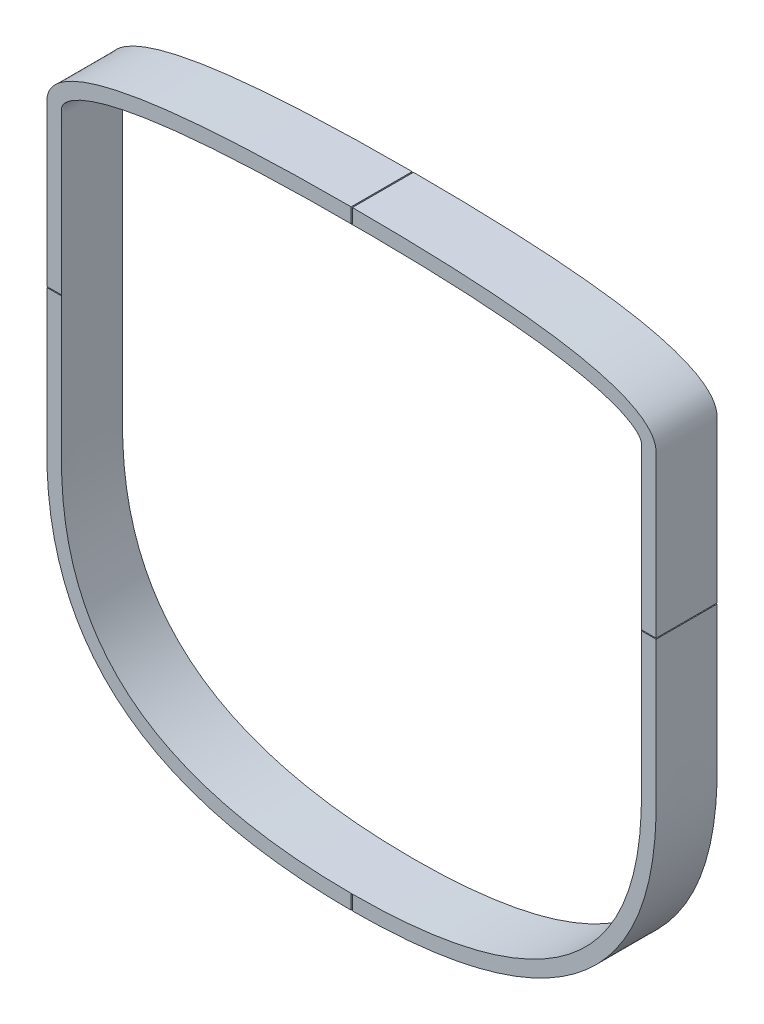
from build123d import *

# Parameters (mm, degrees)
BOSS_EXTRUDE1_DEPTH = 10


with BuildPart() as part:
    # Sketch1 → Boss-Extrude1 (new, symmetric)
    with BuildSketch(Plane.XY):
        with BuildLine():
            Line((-95.144998716, 47.060523193), (-99.799994094, 47.060523194))
            add(Edge.make_bspline(
                [(-99.799994094, 47.060523194), (-99.800007021, 46.135711354), (-99.800068705, 41.700388492), (-99.80014587, 33.754485116), (-99.800505635, 23.223179801), (-99.799679386, 14.4459308), (-99.801136798, 7.426624709), (-99.796894787, 3.033822239), (-99.805308217, -0.465987616), (-99.759141694, -4.156711462), (-99.438712731, -10.542299727), (-98.294238748, -19.729972222), (-95.501671637, -30.617877434), (-91.007467852, -41.089742593), (-84.652074349, -50.663569653), (-76.600245778, -58.862795915), (-67.302957766, -65.435861427), (-53.896056792, -72.115410588), (-36.165000884, -77.150562875), (-18.187624636, -79.297714349), (-6.174368209, -79.759810132), (-1.346346859, -79.801016691), (-0.1, -79.801808559)],
                knots=[0.37088373, 0.37088373, 0.37088373, 0.37088373, 0.375, 0.390625, 0.40625, 0.421875, 0.4296875, 0.4375, 0.44140625, 0.4453125, 0.453125, 0.46875, 0.484375, 0.5, 0.515625, 0.53125, 0.546875, 0.5625, 0.59375, 0.625, 0.640625, 0.64606282, 0.64606282, 0.64606282, 0.64606282], degree=3))
            Line((-0.1, -79.801808559), (-0.1, -75.146205503))
            Line((-0.1, -75.146205503), (0.3, -75.146205503))
            Line((0.3, -75.146205503), (0.3, -79.801724394))
            add(Edge.make_bspline(
                [(0.3, -79.801724394), (2.501532566, -79.799397871), (11.86466932, -79.658552731), (28.468647656, -78.393184478), (49.892541186, -73.78340807), (67.095318032, -66.050228552), (79.086640147, -56.648120321), (86.680517748, -48.016317429), (92.501583857, -38.117867323), (96.476354993, -27.483349983), (98.433155067, -18.360856768), (99.337729137, -11.029098552), (99.655135353, -6.445613725), (99.780918083, -2.7912996), (99.804296451, -0.038361832), (99.799067761, 2.584352582), (99.800472354, 6.091701714), (99.799858203, 10.482871902), (99.800080901, 17.502278893), (99.799972511, 26.279386709), (99.800007066, 36.716753999), (99.800001274, 43.643913188), (99.800000093, 47.060523193)],
                knots=[0.646644559, 0.646644559, 0.646644559, 0.646644559, 0.65625, 0.6875, 0.71875, 0.75, 0.765625, 0.78125, 0.796875, 0.8125, 0.828125, 0.8359375, 0.84375, 0.84765625, 0.8515625, 0.85546875, 0.859375, 0.8671875, 0.875, 0.890625, 0.90625, 0.921457001, 0.921457001, 0.921457001, 0.921457001], degree=3))
            Line((99.800000093, 47.060523193), (95.144998716, 47.060523193))
            Line((95.144998716, 47.060523193), (95.144998716, 47.360523193))
            Line((95.144998716, 47.360523193), (99.799999994, 47.360523193))
            add(Edge.make_bspline(
                [(99.799999994, 47.360523193), (99.799998891, 50.864959172), (99.80000025, 56.124633568), (99.799999953, 63.139577639), (99.800000013, 68.405348483), (99.799999997, 73.671119926), (99.800000001, 78.936891125), (99.799999999, 83.325034106), (99.800000002, 86.835547857), (99.799999994, 89.468434883), (99.800000017, 91.66250196), (99.799999971, 93.417767831), (99.800000113, 94.734183873), (99.799999668, 95.831303359), (99.800000573, 96.708760922), (99.799997771, 97.367504686), (99.800007811, 98.023774591), (99.799972215, 98.578528019), (99.80002125, 99.006164906), (99.800066327, 99.295458307), (99.799683962, 99.514410156), (99.799726653, 99.677266334), (99.802643895, 99.88249116), (99.799343805, 100.0793429)],
                knots=[0.921902091, 0.921902091, 0.921902091, 0.921902091, 0.9375, 0.9453125, 0.953125, 0.9609375, 0.96875, 0.9765625, 0.98046875, 0.984375, 0.98828125, 0.990234375, 0.9921875, 0.994140625, 0.995117188, 0.99609375, 0.997070312, 0.998046875, 0.998535156, 0.999023438, 0.999267578, 0.999511719, 1, 1, 1, 1], degree=3))
            add(Edge.make_bspline(
                [(99.799343805, 100.0793429), (99.79769376, 100.17776877), (99.791771211, 100.404638105), (99.756702617, 100.866154781), (99.681026069, 101.371255742), (99.474830418, 102.302594526), (98.978403603, 103.522379935), (98.211060015, 104.706394838), (97.450923574, 105.606725476), (96.716844631, 106.336037386), (95.739744321, 107.177590333), (94.550465009, 108.03359409), (93.145100655, 108.89131757), (91.75533098, 109.626968724), (90.375947661, 110.276323768), (88.554940758, 111.047853828), (86.286312413, 111.884188002), (83.582091496, 112.733611142), (80.886327919, 113.473235038), (77.306216569, 114.338576161), (72.837150711, 115.246978295), (67.491102847, 116.127565447), (62.153711112, 116.857717776), (55.050159396, 117.6648435), (46.179815673, 118.430829138), (35.555435733, 119.056758148), (24.944271633, 119.472818285), (13.189948298, 119.737206297), (4.980994135, 119.801279512), (0.3, 119.80199352)],
                knots=[0, 0, 0, 0, 0.000244141, 0.000488281, 0.000732422, 0.000976562, 0.001953125, 0.002929688, 0.00390625, 0.004882812, 0.005859375, 0.0078125, 0.009765625, 0.01171875, 0.013671875, 0.015625, 0.01953125, 0.0234375, 0.02734375, 0.03125, 0.0390625, 0.046875, 0.0546875, 0.0625, 0.078125, 0.09375, 0.109375, 0.125, 0.145729296, 0.145729296, 0.145729296, 0.145729296], degree=3))
            Line((0.3, 119.80199352), (0.3, 115.145563586))
            Line((0.3, 115.145563586), (-0.1, 115.145563586))
            Line((-0.1, 115.145563586), (-0.1, 119.801967426))
            add(Edge.make_bspline(
                [(-0.1, 119.801967426), (-2.342411795, 119.801333265), (-8.113407772, 119.77860499), (-17.418616824, 119.658563661), (-28.020749242, 119.370598285), (-38.634834441, 118.900042221), (-49.263994287, 118.195660199), (-58.13525568, 117.350230931), (-65.248057918, 116.451417193), (-70.587886107, 115.637667365), (-75.94234067, 114.643364254), (-80.414328561, 113.614336255), (-84.011794221, 112.606570277), (-86.715444626, 111.737306732), (-88.990738285, 110.875491127), (-90.811622866, 110.078868363), (-92.196773222, 109.402861837), (-93.584786341, 108.637685085), (-94.773007795, 107.876037667), (-95.717641092, 107.178431545), (-96.449965322, 106.576000015), (-97.186184014, 105.883016407), (-97.928763991, 105.062911858), (-98.573473095, 104.17184846), (-99.06327665, 103.27043995), (-99.393526391, 102.489659032), (-99.614870682, 101.719827952), (-99.727313202, 101.084699763), (-99.769423265, 100.710384113), (-99.790336747, 100.411353638), (-99.799235979, 100.166724504), (-99.800205476, 99.984508899), (-99.799847623, 99.869027792), (-99.799823906, 99.74060093), (-99.799792486, 99.523798108), (-99.80002485, 99.25143402), (-99.800288052, 98.810752814), (-99.800517977, 98.261733031), (-99.800636847, 97.602387822), (-99.800637755, 96.723799284), (-99.800418096, 95.626005841), (-99.800042438, 94.309623403), (-99.799832205, 92.994001879), (-99.799782847, 91.239340091), (-99.799981835, 89.045558241), (-99.800160348, 86.412399842), (-99.800244895, 83.779420706), (-99.800272173, 80.268756937), (-99.800180454, 75.88050538), (-99.800003308, 70.614722004), (-99.79990146, 65.349029555), (-99.799872223, 60.083306937), (-99.799896006, 54.087142812), (-99.799955137, 49.846215152), (-99.799989899, 47.360523194)],
                knots=[0.146319748, 0.146319748, 0.146319748, 0.146319748, 0.15625, 0.171875, 0.1875, 0.203125, 0.21875, 0.234375, 0.2421875, 0.25, 0.2578125, 0.265625, 0.26953125, 0.2734375, 0.27734375, 0.279296875, 0.28125, 0.283203125, 0.28515625, 0.286132812, 0.287109375, 0.288085938, 0.2890625, 0.290039062, 0.290527344, 0.291015625, 0.291503906, 0.291748047, 0.291992188, 0.292114258, 0.292236328, 0.292358398, 0.292480469, 0.292724609, 0.29296875, 0.293457031, 0.293945312, 0.294921875, 0.295898438, 0.296875, 0.298828125, 0.30078125, 0.302734375, 0.3046875, 0.30859375, 0.3125, 0.31640625, 0.3203125, 0.328125, 0.3359375, 0.34375, 0.3515625, 0.359375, 0.370438637, 0.370438637, 0.370438637, 0.370438637], degree=3))
            Line((-99.799989899, 47.360523194), (-95.144998716, 47.360523193))
            Line((-95.144998716, 47.360523193), (-95.144998716, 47.060523193))
        make_face()
        with BuildLine():
            add(Edge.make_bspline(
                [(95, 99.9999764), (94.998158654, 100.111323776), (94.988555492, 100.330452079), (94.928497736, 100.650738133), (94.829433653, 100.960373571), (94.562305646, 101.554381223), (93.979381252, 102.319240831), (93.026321659, 103.206894733), (91.676242438, 104.196155839), (89.764336677, 105.289109327), (86.722535982, 106.65506279), (82.554332223, 108.082970586), (76.113161241, 109.753501279), (67.445465525, 111.354602755), (54.260097881, 113.017880155), (36.673333772, 114.303280105), (21.096742339, 114.795958764), (10.107934879, 114.951244021), (4.90353807, 114.992504049), (-0.322483783, 115.004815996), (-7.3651861, 114.983564876), (-16.031122652, 114.882852335), (-26.963634466, 114.606505108), (-37.955965783, 114.136610186), (-48.857717823, 113.411493768), (-58.667004405, 112.474338886), (-66.629478523, 111.426131298), (-72.931735306, 110.3437474), (-78.167831479, 109.236295863), (-83.130416471, 107.912106678), (-87.312276912, 106.426045165), (-90.342572834, 104.992935461), (-92.21152013, 103.84448353), (-93.358305632, 102.913020094), (-93.97668009, 102.284806185), (-94.53132619, 101.602044508), (-94.896611638, 100.907705453), (-94.986875212, 100.309217247), (-95.000321451, 100.090667807), (-94.999611402, 99.760684992), (-95.001345658, 97.724085186), (-94.999452202, 93.980426074), (-95.00058471, 84.227615871), (-94.999736182, 68.372971062), (-95.00003311, 40.187168716), (-95.000534612, 17.476051094), (-94.999924912, 2.196714309), (-95.000177274, 0.435157827), (-94.998228748, -2.332268019), (-94.810105559, -8.199272197), (-93.871284142, -17.144653487), (-91.432249232, -27.575340796), (-87.850239506, -36.456262715), (-83.683778334, -43.555042899), (-79.318518097, -49.212412524), (-73.508761462, -55.035501078), (-65.814198627, -60.71878416), (-56.809924782, -65.370143365), (-47.639489074, -68.795115094), (-37.877110836, -71.453415015), (-26.887713018, -73.43008817), (-15.418130014, -74.581308404), (-6.148458685, -74.967857061), (0.891896226, -75.017340521), (7.960377027, -74.915107437), (16.784772866, -74.468314785), (27.313255297, -73.335911103), (37.740953191, -71.474587563), (51.381892539, -67.828456194), (64.481920694, -61.968992844), (74.295409671, -54.310428112), (79.225965526, -49.215189273), (83.603106958, -43.746277093), (88.134079606, -36.084451181), (91.828286828, -26.213569542), (94.081892112, -15.744880147), (94.815561187, -7.825596661), (94.971539529, -2.876580077), (94.99682394, -1.126336408), (95.001808453, 0.624296271), (94.999406626, 2.831564682), (95.000343414, 6.333130188), (94.999876147, 10.710085088), (95.0000018, 14.328368425), (94.99999993, 16.312588233), (95.000000019, 16.662744668), (94.999999995, 17.012901104), (95.000000001, 17.36305754), (95, 17.713213976), (95, 18.063370412), (95, 18.413526848), (95, 18.763683284), (95, 19.113839719), (95, 19.463996155), (95, 19.814152591), (95, 20.164309027), (95, 20.514465463), (95, 20.864621899), (95, 21.214778334), (95, 21.56493477), (95, 21.915091206), (95, 22.265247642), (95, 22.615404078), (95, 22.965560514), (95, 23.31571695), (95, 23.665873385), (95, 24.016029821), (95, 24.366186257), (95, 24.716342693), (95, 25.066499129), (95, 25.416655565), (95, 25.766812), (95, 26.116968436), (95, 26.467124872), (95, 26.817281308), (95, 27.167437744), (95, 27.51759418), (95, 27.867750616), (95, 28.217907051), (95, 28.568063487), (95, 28.918219923), (95, 29.268376359), (95, 29.618532795), (95, 29.968689231), (95, 30.318845666), (95, 30.669002102), (95, 31.019158538), (95, 31.369314974), (95, 31.71947141), (95, 32.069627846), (95, 32.419784282), (95, 32.769940717), (95, 33.120097153), (95, 33.470253589), (95, 33.820410025), (95, 34.170566461), (95, 34.520722897), (95, 34.870879332), (95, 35.221035768), (95, 35.571192204), (95, 35.92134864), (95, 36.271505076), (95, 36.621661512), (95, 36.971817947), (95, 37.321974383), (95, 37.672130819), (95, 38.022287255), (95, 38.372443691), (95, 38.722600127), (95, 39.072756563), (95, 39.422912998), (95, 39.773069434), (95, 40.12322587), (95, 40.473382306), (95, 40.823538742), (95, 41.173695178), (95, 41.523851613), (95, 41.874008049), (95, 42.224164485), (95, 42.574320921), (95, 42.924477357), (95, 43.274633793), (95, 43.624790229), (95, 43.974946664), (95, 44.3251031), (95, 44.675259536), (95, 45.025415972), (95, 45.375572408), (95, 45.725728844), (95, 46.075885279), (95, 46.426041715), (95, 46.776198151), (95, 47.126354587), (95, 47.476511023), (95, 47.826667459), (95, 48.176823895), (95, 48.52698033), (95, 48.877136766), (95, 49.227293202), (95, 49.577449638), (95, 49.927606074), (95, 50.27776251), (95, 50.627918945), (95, 50.978075381), (95, 51.328231817), (95, 51.678388253), (95, 52.028544689), (95, 52.378701125), (95, 52.728857561), (95, 53.079013996), (95, 53.429170432), (95, 53.779326868), (95, 54.129483304), (95, 54.47963974), (95, 54.829796176), (95, 55.179952611), (95, 55.530109047), (95, 55.880265483), (95, 56.230421919), (95, 56.580578355), (95, 56.930734791), (95, 57.280891227), (95, 57.631047662), (95, 57.981204098), (95, 58.331360534), (95, 58.68151697), (95, 59.031673406), (95, 59.381829842), (95, 59.731986277), (95, 60.082142713), (95, 60.432299149), (95, 60.782455585), (95, 61.132612021), (95, 61.482768457), (95, 61.832924893), (95, 62.183081328), (95, 62.533237764), (95, 62.8833942), (95, 63.233550636), (95, 63.583707072), (95, 63.933863508), (95, 64.284019943), (95, 64.634176379), (95, 64.984332815), (95, 65.334489251), (95, 65.684645687), (95, 66.034802123), (95, 66.384958558), (95, 66.735114994), (95, 67.08527143), (95, 67.435427866), (95, 67.785584302), (95, 68.135740738), (95, 68.485897174), (95, 68.836053609), (95, 69.186210045), (95, 69.536366481), (95, 69.886522917), (95, 70.236679353), (95, 70.586835789), (95, 70.936992224), (95, 71.28714866), (95, 71.637305096), (95, 71.987461532), (95, 72.337617968), (95, 72.687774404), (95, 73.03793084), (95, 73.388087275), (95, 73.738243711), (95, 74.088400147), (95, 74.438556583), (95, 74.788713019), (95, 75.138869455), (95, 75.48902589), (95, 75.839182326), (95, 76.189338762), (95, 76.539495198), (95, 76.889651634), (95, 77.23980807), (95, 77.589964506), (95, 77.940120941), (95, 78.290277377), (95, 78.640433813), (95, 78.990590249), (95, 79.340746685), (95, 79.690903121), (95, 80.041059556), (95, 80.391215992), (95, 80.741372428), (95, 81.091528864), (95, 81.4416853), (95, 81.791841736), (95, 82.141998172), (95, 82.492154607), (95, 82.842311043), (95, 83.192467479), (95, 83.542623915), (95, 83.892780351), (95, 84.242936787), (95, 84.593093222), (95, 84.943249658), (95, 85.293406094), (95, 85.64356253), (95, 85.993718966), (95, 86.343875402), (95, 86.694031838), (95, 87.044188273), (95, 87.394344709), (95, 87.744501145), (95, 88.094657581), (95, 88.444814017), (95, 88.794970453), (95, 89.145126888), (95, 89.495283324), (95, 89.84543976), (95, 90.195596196), (95, 90.545752632), (95, 90.895909068), (95, 91.246065504), (95, 91.596221939), (95, 91.946378375), (95, 92.296534811), (95, 92.646691247), (95, 92.996847683), (95, 93.347004119), (95, 93.697160554), (95, 94.04731699), (95, 94.397473426), (95, 94.747629862), (95, 95.097786298), (95, 95.447942734), (95, 95.798099169), (94.999999998, 96.148255605), (95.000000006, 96.498412041), (94.999999976, 96.848568478), (95.000000089, 97.198724911), (94.999999668, 97.548881356), (95.000001238, 97.899037757), (94.999995381, 98.249194325), (95.00001724, 98.599350267), (94.999935661, 98.949508546), (95.000240118, 99.299658103), (94.999103869, 99.649840208), (95.001930894, 99.883213967), (95, 99.9999764)],
                knots=[0, 0, 0, 0, 0.000495413, 0.000974356, 0.001445521, 0.001939312, 0.003867498, 0.005664183, 0.007730435, 0.011300748, 0.015444534, 0.022555493, 0.030881167, 0.045043753, 0.061751684, 0.090013261, 0.123491819, 0.131103125, 0.138928425, 0.146656694, 0.154363659, 0.170274933, 0.185229484, 0.203037369, 0.219241711, 0.233853899, 0.246889497, 0.254977191, 0.262309713, 0.270703955, 0.277822243, 0.282027633, 0.285605197, 0.287554362, 0.288588997, 0.28952012, 0.291476388, 0.29196221, 0.292205708, 0.292450459, 0.293430559, 0.301271361, 0.309112163, 0.336840089, 0.371838576, 0.43456499, 0.437925334, 0.43984553, 0.44240556, 0.450242671, 0.46596488, 0.482358403, 0.497762126, 0.508387704, 0.518904365, 0.529479595, 0.544907773, 0.561269893, 0.574423016, 0.588416061, 0.606247981, 0.624054608, 0.639683002, 0.647524959, 0.655389317, 0.671145562, 0.686832306, 0.702494704, 0.718232126, 0.749658545, 0.765474223, 0.773344002, 0.781172907, 0.796611323, 0.812727204, 0.827870456, 0.844150207, 0.848045333, 0.849909138, 0.851940932, 0.855837224, 0.859733515, 0.867526097, 0.87531868, 0.875838185, 0.876357691, 0.876877196, 0.877396702, 0.877916207, 0.878435713, 0.878955218, 0.879474724, 0.879994229, 0.880513735, 0.88103324, 0.881552746, 0.882072251, 0.882591757, 0.883111262, 0.883630768, 0.884150273, 0.884669779, 0.885189284, 0.88570879, 0.886228295, 0.886747801, 0.887267306, 0.887786812, 0.888306317, 0.888825823, 0.889345328, 0.889864834, 0.890384339, 0.890903845, 0.89142335, 0.891942856, 0.892462361, 0.892981867, 0.893501372, 0.894020878, 0.894540383, 0.895059889, 0.895579394, 0.8960989, 0.896618405, 0.897137911, 0.897657416, 0.898176922, 0.898696427, 0.899215933, 0.899735438, 0.900254944, 0.900774449, 0.901293955, 0.90181346, 0.902332966, 0.902852471, 0.903371977, 0.903891482, 0.904410988, 0.904930493, 0.905449999, 0.905969504, 0.90648901, 0.907008515, 0.907528021, 0.908047526, 0.908567032, 0.909086537, 0.909606043, 0.910125548, 0.910645054, 0.911164559, 0.911684065, 0.91220357, 0.912723076, 0.913242581, 0.913762087, 0.914281592, 0.914801098, 0.915320603, 0.915840109, 0.916359614, 0.91687912, 0.917398625, 0.917918131, 0.918437636, 0.918957142, 0.919476647, 0.919996153, 0.920515658, 0.921035164, 0.921554669, 0.922074175, 0.92259368, 0.923113186, 0.923632691, 0.924152197, 0.924671702, 0.925191208, 0.925710713, 0.926230219, 0.926749724, 0.92726923, 0.927788735, 0.928308241, 0.928827746, 0.929347252, 0.929866757, 0.930386263, 0.930905768, 0.931425274, 0.931944779, 0.932464285, 0.93298379, 0.933503296, 0.934022801, 0.934542307, 0.935061812, 0.935581318, 0.936100823, 0.936620329, 0.937139834, 0.93765934, 0.938178845, 0.938698351, 0.939217856, 0.939737362, 0.940256867, 0.940776373, 0.941295878, 0.941815384, 0.942334889, 0.942854395, 0.9433739, 0.943893406, 0.944412911, 0.944932417, 0.945451922, 0.945971428, 0.946490933, 0.947010439, 0.947529944, 0.94804945, 0.948568955, 0.949088461, 0.949607966, 0.950127472, 0.950646977, 0.951166483, 0.951685988, 0.952205494, 0.952724999, 0.953244505, 0.95376401, 0.954283516, 0.954803021, 0.955322527, 0.955842032, 0.956361538, 0.956881043, 0.957400549, 0.957920054, 0.95843956, 0.958959065, 0.959478571, 0.959998076, 0.960517582, 0.961037087, 0.961556593, 0.962076098, 0.962595604, 0.963115109, 0.963634615, 0.96415412, 0.964673626, 0.965193131, 0.965712637, 0.966232142, 0.966751648, 0.967271153, 0.967790659, 0.968310164, 0.96882967, 0.969349175, 0.969868681, 0.970388186, 0.970907692, 0.971427197, 0.971946703, 0.972466208, 0.972985714, 0.973505219, 0.974024725, 0.97454423, 0.975063736, 0.975583241, 0.976102747, 0.976622252, 0.977141758, 0.977661263, 0.978180769, 0.978700274, 0.97921978, 0.979739285, 0.980258791, 0.980778296, 0.981297802, 0.981817307, 0.982336813, 0.982856318, 0.983375824, 0.983895329, 0.984414835, 0.98493434, 0.985453846, 0.985973351, 0.986492857, 0.987012362, 0.987531868, 0.988051373, 0.988570879, 0.989090384, 0.98960989, 0.990129395, 0.990648901, 0.991168406, 0.991687912, 0.992207417, 0.992726923, 0.993246428, 0.993765934, 0.994285439, 0.994804945, 0.99532445, 0.995843956, 0.996363461, 0.996882967, 0.997402472, 0.997921978, 0.998441483, 0.998960989, 0.999480494, 1, 1, 1, 1], degree=3))
        make_face(mode=Mode.SUBTRACT)
    extrude(amount=BOSS_EXTRUDE1_DEPTH, both=True)


solid = part.part
